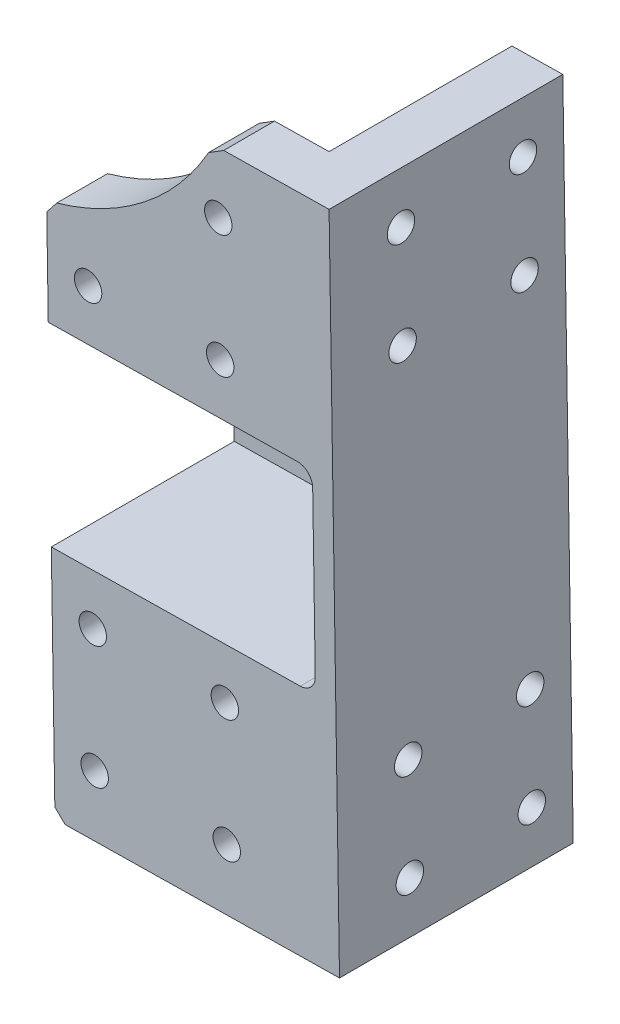
from build123d import *

# Parameters (mm, degrees)
SKETCH1_R          = 1.35
EXTRUDE1_DEPTH     = 23
SKETCH2_R          = 1.35
CUT_EXTRUDE1_DEPTH = 10
CHAMFER3_SIZE      = 1
EXTRUDE2_DEPTH     = 18
EXTRUDE3_DEPTH     = 18


with BuildPart() as part:
    # Sketch1 → Extrude1 (new body)
    with BuildSketch(Plane.XY):
        with BuildLine():
            Line((134.244131426, -107.376468954), (135.270230766, -172.368369374))
            Line((135.270230766, -172.368369374), (107.273719816, -172.810381397))
            Line((107.273719816, -172.810381397), (106.44776294, -120.495264366))
            ThreePointArc((106.44776294, -120.495264366), (116.078507859, -115.825445612), (122.873690334, -107.555986741))
            Line((122.873690334, -107.555986741), (134.244131426, -107.376468954))
        make_face()
        with Locations((110.720688645, -137.750476655)):
            Circle(SKETCH1_R, mode=Mode.SUBTRACT)
        with Locations((111.178504518, -166.747984476)):
            Circle(SKETCH1_R, mode=Mode.SUBTRACT)
        with Locations((124.176884602, -166.542764608)):
            Circle(SKETCH1_R, mode=Mode.SUBTRACT)
        with Locations((123.987450878, -154.544259915)):
            Circle(SKETCH1_R, mode=Mode.SUBTRACT)
        with Locations((110.989070794, -154.749479783)):
            Circle(SKETCH1_R, mode=Mode.SUBTRACT)
        with Locations((123.529652711, -125.547873574)):
            Circle(SKETCH1_R, mode=Mode.SUBTRACT)
        with Locations((110.531272627, -125.753093442)):
            Circle(SKETCH1_R, mode=Mode.SUBTRACT)
        with Locations((123.340218986, -113.549368881)):
            Circle(SKETCH1_R, mode=Mode.SUBTRACT)
        with Locations((128.65529324, -133.466326068)):
            Circle(SKETCH1_R, mode=Mode.SUBTRACT)
        with Locations((110.862781644, -146.750476655)):
            Circle(SKETCH1_R, mode=Mode.SUBTRACT)
        with Locations((128.860538683, -146.466326068)):
            Circle(SKETCH1_R, mode=Mode.SUBTRACT)
    extrude(amount=EXTRUDE1_DEPTH)

    # Sketch2 → Cut-Extrude1 (cut)
    with BuildSketch(Plane(origin=(132.515828327, 2.092174611, 0), x_dir=(0, 0, -1), z_dir=(0.9998753910699589, 0.01578614369301875, 0))):
        with Locations(Location((-16, -114.482286036, 0), (0, 0, 90))):
            Circle(SKETCH2_R)
        with Locations(Location((-4, -114.482286036, 0), (0, 0, 90))):
            Circle(SKETCH2_R)
        with Locations(Location((-16, -124.482286036, 0), (0, 0, 90))):
            Circle(SKETCH2_R)
        with Locations(Location((-4, -124.482286036, 0), (0, 0, 90))):
            Circle(SKETCH2_R)
        with Locations(Location((-16, -169.482286036, 0), (0, 0, 90))):
            Circle(SKETCH2_R)
        with Locations(Location((-4, -169.482286036, 0), (0, 0, 90))):
            Circle(SKETCH2_R)
        with Locations(Location((-16, -159.482286036, 0), (0, 0, 90))):
            Circle(SKETCH2_R)
        with Locations(Location((-4, -159.482286036, 0), (0, 0, 90))):
            Circle(SKETCH2_R)
    extrude(amount=-CUT_EXTRUDE1_DEPTH, mode=Mode.SUBTRACT)

    # Chamfer3
    # the kernel refuses this chamfer: 1 mm, written as the material it takes off along each edge
    with BuildSketch(Plane(origin=(107.273719816, -172.810381397, -2.571682988), x_dir=(-0.01578614369302038, 0.9998753910699589, 0), z_dir=(0, 0, 1))) as chamfer3_piece_1:
        Polygon((CHAMFER3_SIZE, 0), (0, -CHAMFER3_SIZE), (0, 0), align=None)
    extrude(amount=28.143365976, mode=Mode.SUBTRACT)
    with BuildSketch(Plane(origin=(106.44776294, -120.495264366, -2.646322056), x_dir=(0.9673390331642948, 0.2534860842665082, 0), z_dir=(0, 0, 1))) as chamfer3_piece_2:
        with BuildLine():
            Line((1.026523691, 0), (-CHAMFER3_SIZE * 0.238183944659, -CHAMFER3_SIZE * 0.971220061833))
            Line((-CHAMFER3_SIZE * 0.238183944659, -CHAMFER3_SIZE * 0.971220061833), (0, 0))
            ThreePointArc((0, 0), (0.529135289, -0.00526427), (1.026523691, 0))
        make_face()
    extrude(amount=28.292644112, mode=Mode.SUBTRACT)
    with BuildSketch(Plane(origin=(122.873690334, -107.555986741, -2.676981296), x_dir=(0.9998753910699592, 0.015786143693006172, 0), z_dir=(0, 0, 1))) as chamfer3_piece_3:
        with BuildLine():
            Line((CHAMFER3_SIZE, 0), (-0.504457815, -0.904781971))
            ThreePointArc((-0.504457815, -0.904781971), (-0.256001011, -0.470163527), (0, 0))
            Line((0, 0), (CHAMFER3_SIZE, 0))
        make_face()
    extrude(amount=28.353962591, mode=Mode.SUBTRACT)

    # Sketch3 → Extrude2 (cut)
    with BuildSketch(Plane.XY.offset(23)):
        with BuildLine():
            Line((104.011515413, -130.855030895), (131.107623287, -130.427234536))
            ThreePointArc((131.107623287, -130.427234536), (132.175086772, -130.849775884), (132.631115589, -131.903368407))
            Line((132.631115589, -131.903368407), (132.883719463, -147.90299458))
            ThreePointArc((132.883719463, -147.90299458), (132.461178115, -148.970458066), (131.407585592, -149.426486882))
            Line((131.407585592, -149.426486882), (104.311477719, -149.854283242))
            ThreePointArc((104.311477719, -149.854283242), (103.244014233, -149.431741893), (102.787985417, -148.378149371))
            Line((102.787985417, -148.378149371), (102.535381542, -132.378523198))
            ThreePointArc((102.535381542, -132.378523198), (102.957922891, -131.311059712), (104.011515413, -130.855030895))
        make_face()
    extrude(amount=-EXTRUDE2_DEPTH, mode=Mode.SUBTRACT)

    # Sketch4 → Extrude3 (cut)
    with BuildSketch(Plane(origin=(0, 0, 0), x_dir=(-1, 0, 0), z_dir=(0, 0, -1))):
        with BuildLine():
            Line((-128.995288436, -91.654520496), (-129.552584273, -126.952969799))
            ThreePointArc((-129.552584273, -126.952969799), (-129.130042924, -128.020433284), (-128.076450401, -128.476462101))
            Line((-128.076450401, -128.476462101), (-95.502554389, -128.990742388))
            ThreePointArc((-95.502554389, -128.990742388), (-94.435090904, -128.568201039), (-93.979062087, -127.514608517))
            Line((-93.979062087, -127.514608517), (-93.42176625, -92.216159214))
            ThreePointArc((-93.42176625, -92.216159214), (-93.844307599, -91.148695728), (-94.897900122, -90.692666912))
            Line((-94.897900122, -90.692666912), (-127.471796134, -90.178386625))
            ThreePointArc((-127.471796134, -90.178386625), (-128.539259619, -90.600927973), (-128.995288436, -91.654520496))
        make_face()
        with BuildLine():
            Line((-129.963024009, -152.949729966), (-130.439103933, -183.104060885))
            ThreePointArc((-130.439103933, -183.104060885), (-130.016562585, -184.17152437), (-128.962970062, -184.627553187))
            Line((-128.962970062, -184.627553187), (-101.681956846, -185.058268853))
            ThreePointArc((-101.681956846, -185.058268853), (-100.61449336, -184.635727504), (-100.158464544, -183.582134982))
            Line((-100.158464544, -183.582134982), (-99.682384619, -153.427804063))
            ThreePointArc((-99.682384619, -153.427804063), (-100.104925968, -152.360340578), (-101.15851849, -151.904311761))
            Line((-101.15851849, -151.904311761), (-128.439531706, -151.473596095))
            ThreePointArc((-128.439531706, -151.473596095), (-129.506995192, -151.896137444), (-129.963024009, -152.949729966))
        make_face()
    extrude(amount=-EXTRUDE3_DEPTH, mode=Mode.SUBTRACT)


solid = part.part
